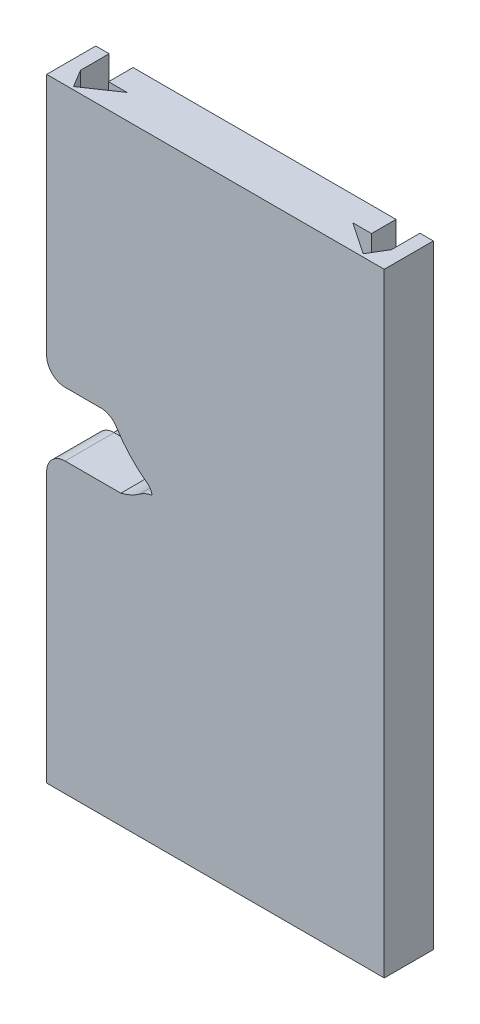
from build123d import *
from build123d.topology import SkipClean

# Parameters (mm, degrees)
SKETCH1_W           = 55
SKETCH1_H           = 8
BOSS_EXTRUDE1_DEPTH = 100
SKETCH4_R           = 19
CUT_EXTRUDE3_DEPTH  = 3.56
CUT_EXTRUDE4_DEPTH  = 2
CUT_EXTRUDE5_DEPTH  = 16
BOSS_EXTRUDE2_START = 2
BOSS_EXTRUDE2_DEPTH = 2
FILLET1_R           = 3
FILLET2_R           = 3
FILLET3_R           = 3
FILLET4_R           = 2
BOSS_EXTRUDE3_DEPTH = 4
CUT_EXTRUDE9_DEPTH  = 39
CUT_EXTRUDE13_DEPTH = 108
BOSS_EXTRUDE4_DEPTH = 18
FILLET5_R           = 0.5


with BuildPart() as part:
    # Sketch1 → Boss-Extrude1 (new body)
    with BuildSketch(Plane(origin=(0, 0, 0), x_dir=(1, 0, 0), z_dir=(0, 1, 0))):
        Rectangle(SKETCH1_W, SKETCH1_H)
    extrude(amount=BOSS_EXTRUDE1_DEPTH)

    # Sketch4 → Cut-Extrude3 (cut)
    with BuildSketch(Plane(origin=(0, 0, -4), x_dir=(-1, 0, 0), z_dir=(0, 0, -1))):
        with Locations((0, 65.948341349)):
            Circle(SKETCH4_R)
    extrude(amount=-CUT_EXTRUDE3_DEPTH, mode=Mode.SUBTRACT)

    # Sketch5 → Cut-Extrude4 (cut)
    with BuildSketch(Plane(origin=(0, 0, -4), x_dir=(-1, 0, 0), z_dir=(0, 0, -1))):
        with BuildLine():
            Line((0, 46.948341349), (27.5, 46.948341349))
            Line((27.5, 46.948341349), (27.5, 84.948341349))
            Line((27.5, 84.948341349), (0, 84.948341349))
            ThreePointArc((0, 84.948341349), (19, 65.948341349), (0, 46.948341349))
        make_face()
    extrude(amount=-CUT_EXTRUDE4_DEPTH, mode=Mode.SUBTRACT)

    # Sketch6 → Cut-Extrude5 (cut)
    with BuildSketch(Plane(origin=(0, 0, -2), x_dir=(-1, 0, 0), z_dir=(0, 0, -1))):
        with BuildLine():
            Line((15.414617012, 46.948341349), (27.5, 46.948341349))
            Line((27.5, 46.948341349), (27.5, 57.34244177))
            Line((27.5, 57.34244177), (16.93925891, 57.34244177))
            ThreePointArc((16.93925891, 57.34244177), (13.716933305, 52.801260277), (9.316482273, 49.389260515))
            add(Edge.make_bspline(
                [(9.316482273, 49.389260515), (9.656060905, 49.327672788), (9.995639536, 49.266085061), (10.335218168, 49.204497334)],
                knots=[0, 0, 0, 0, 0.453327557, 0.453327557, 0.453327557, 0.453327557], degree=3))
            ThreePointArc((10.335218168, 49.204497334), (11.386910009, 48.891383158), (12.344973185, 48.356396089))
            ThreePointArc((12.344973185, 48.356396089), (13.813009587, 47.506772296), (15.414617012, 46.948341349))
        make_face()
    extrude(amount=-CUT_EXTRUDE5_DEPTH, mode=Mode.SUBTRACT)

    # Sketch7 → Boss-Extrude2 (add)
    with BuildSketch(Plane(origin=(0, 0, -2), x_dir=(-1, 0, 0), z_dir=(0, 0, -1)).offset(BOSS_EXTRUDE2_START)):
        with BuildLine():
            Line((0, 46.948341349), (15.414617012, 46.948341349))
            ThreePointArc((15.414617012, 46.948341349), (13.813009587, 47.506772296), (12.344973185, 48.356396089))
            ThreePointArc((12.344973185, 48.356396089), (11.386910009, 48.891383158), (10.335218168, 49.204497334))
            Line((10.335218168, 49.204497334), (9.316482273, 49.389260515))
            ThreePointArc((9.316482273, 49.389260515), (4.815468002, 47.568698591), (0, 46.948341349))
        make_face()
    extrude(amount=-BOSS_EXTRUDE2_DEPTH)

    # Fillet1
    fillet1_edges = [part.edges().sort_by_distance(p)[0] for p in [
        (-27.5, 46.948341349, 0),
    ]]
    fillet(fillet1_edges, radius=FILLET1_R)

    # Fillet2
    fillet2_edges = [part.edges().sort_by_distance(p)[0] for p in [
        (-27.5, 57.34244177, 1),
    ]]
    fillet(fillet2_edges, radius=FILLET2_R)

    # Fillet3
    fillet3_edges = [part.edges().sort_by_distance(p)[0] for p in [
        (-16.93925891, 57.34244177, 1.78),
    ]]
    fillet(fillet3_edges, radius=FILLET3_R)

    # Fillet4
    # the kernel refuses this fillet: 2 mm, written as the material it adds along each edge
    with BuildSketch(Plane(origin=(-9.316482273, 49.389260515, -0.44), x_dir=(-0.8420947177301665, 0.5393296639078471, 0), z_dir=(0, 0, 1))) as fillet4_piece_1:
        with BuildLine():
            CenterArc((2.285143138, 1.996733658), FILLET4_R, 220.22985095, 46.495139538)
            Line((0.758223851, 0.705022587), (0, 0))
            ThreePointArc((0, 0), (1.08544299, 0.031030246), (2.170885981, 0))
        make_face()
    extrude(amount=4.44)

    # Sketch8 → Boss-Extrude3 (add)
    with SkipClean():  # the faces are left unmerged after this step: merging them gives an invalid solid
        with BuildSketch(Plane(origin=(0, 0, -4), x_dir=(-1, 0, 0), z_dir=(0, 0, -1))):
            with BuildLine():
                Line((26.088640722, 4.806504153), (22.273821869, 4.806504153))
                Line((22.273821869, 4.806504153), (22.273821869, 31.413664101))
                Line((22.273821869, 31.413664101), (24.599018881, 43.221316386))
                ThreePointArc((24.599018881, 43.221316386), (25.224862201, 45.756953754), (26.088640722, 48.221710007))
                Line((26.088640722, 48.221710007), (26.088640722, 4.806504153))
            make_face()
        extrude(amount=BOSS_EXTRUDE3_DEPTH)

    # Sketch10 → Cut-Extrude9 (cut)
    with SkipClean():  # the faces are left unmerged after this step: merging them gives an invalid solid
        with BuildSketch(Plane(origin=(0, 100, 0), x_dir=(1, 0, 0), z_dir=(0, 1, 0))):
            Polygon((-21.421951451, 4), (-25.321951451, 4), (-25.321951451, -0.657162479), (-23.589826686, -3.532235176), (-18.397407116, 0), (-21.421951451, 0), align=None)
        extrude(amount=-CUT_EXTRUDE9_DEPTH, mode=Mode.SUBTRACT)

    # Sketch11 → Cut-Extrude13 (cut)
    with SkipClean():  # the faces are left unmerged after this step: merging them gives an invalid solid
        with BuildSketch(Plane(origin=(0, 100, 0), x_dir=(1, 0, 0), z_dir=(0, 1, 0))):
            Polygon((21.421951451, 4), (25.321951451, 4), (25.321951451, -0.657162479), (23.589826686, -3.532235176), (18.397407116, 0), (21.421951451, 0), align=None)
        extrude(amount=-CUT_EXTRUDE13_DEPTH, mode=Mode.SUBTRACT)

    # Sketch12 → Boss-Extrude4 (add)
    with SkipClean():  # the faces are left unmerged after this step: merging them gives an invalid solid
        with BuildSketch(Plane.XZ.offset(-4.806504153)):
            Polygon((-23.25622165, -11.019758414), (-21.45622165, -9.537592081), (-23.25622165, -9.537592081), (-23.25622165, -8), (-25.25622165, -8), (-25.25622165, -9.537592081), (-25.25622165, -11.019758414), align=None)
        extrude(amount=-BOSS_EXTRUDE4_DEPTH)

    # Fillet5
    # the kernel refuses this fillet: 0.5 mm, written as the material it takes off along each edge
    with BuildSketch(Plane(origin=(-26.088640722, 48.221710007, -4), x_dir=(0, -1, 0), z_dir=(0, 0, -1))) as fillet5_piece_1:
        with BuildLine():
            CenterArc((3.006099278, -0.5), FILLET5_R, 90, 164.292569468)
            ThreePointArc((2.870736632, -0.981328322), (1.421812921, -0.530318544), (0, 0))
            Line((0, 0), (3.006099278, 0))
        make_face()
    extrude(amount=11.584578962, mode=Mode.SUBTRACT)


solid = part.part
